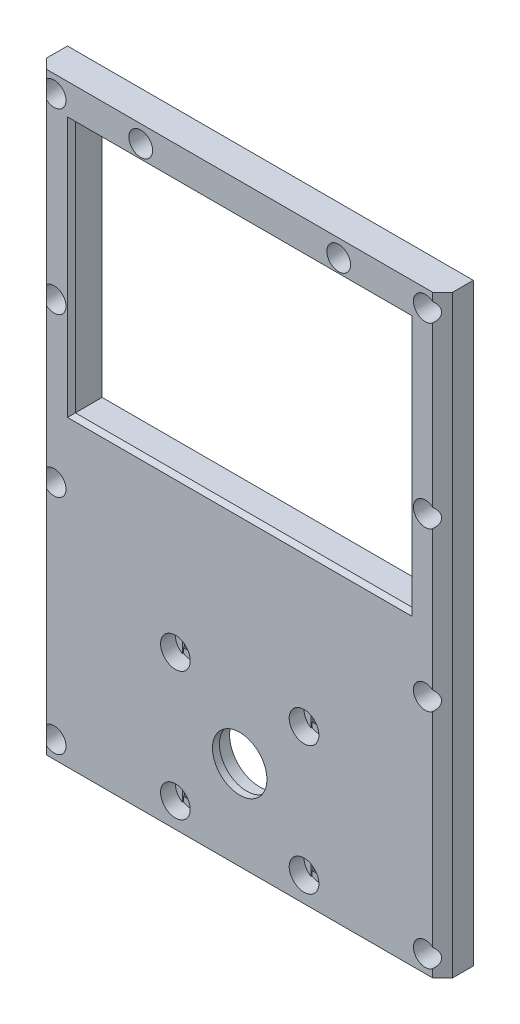
from build123d import *

# Parameters (mm, degrees)
SKETCH1_W           = 82
SKETCH1_H           = 120
SKETCH1_W_2         = 68
SKETCH1_H_2         = 106
BOSS_EXTRUDE1_DEPTH = 7
SKETCH2_W           = 68
SKETCH2_H           = 36
BOSS_EXTRUDE2_DEPTH = 7
SKETCH3_R           = 5.5
CUT_EXTRUDE1_DEPTH  = 74.006848994
SKETCH4_R           = 6.05
CUT_EXTRUDE2_DEPTH  = 5.6
SKETCH5_R           = 11
CUT_EXTRUDE3_DEPTH  = 3
SKETCH6_R           = 1.6
CUT_EXTRUDE4_DEPTH  = 74.006848994
SKETCH7_W           = 50
SKETCH7_H           = 38
CUT_EXTRUDE5_DEPTH  = 1
SKETCH8_R           = 3
CUT_EXTRUDE6_DEPTH  = 3
SKETCH9_R           = 1.35
CUT_EXTRUDE7_DEPTH  = 74.006848994
SKETCH10_R          = 2.4
CUT_EXTRUDE8_DEPTH  = 5
CHAMFER1_SIZE       = 2
SKETCH11_W          = 68
SKETCH11_H          = 19
BOSS_EXTRUDE3_DEPTH = 7
SKETCH12_R          = 1.35
CUT_EXTRUDE9_DEPTH  = 74.006848994
SKETCH13_R          = 2.4
CUT_EXTRUDE10_DEPTH = 5
CHAMFER2_SIZE       = 0.8
CUT_EXTRUDE11_DEPTH = 0.2
SKETCH15_W          = 2.7
SKETCH15_H          = 2.7
CUT_EXTRUDE12_DEPTH = 0.2
CUT_EXTRUDE13_DEPTH = 0.2
SKETCH17_W          = 3.2
SKETCH17_H          = 3.2
CUT_EXTRUDE14_DEPTH = 0.2


with BuildPart() as part:
    # Sketch1 → Boss-Extrude1 (new body)
    with BuildSketch(Plane.XY):
        Rectangle(SKETCH1_W, SKETCH1_H)
        Rectangle(SKETCH1_W_2, SKETCH1_H_2, mode=Mode.SUBTRACT)
    extrude(amount=BOSS_EXTRUDE1_DEPTH)

    # Sketch2 → Boss-Extrude2 (add)
    with BuildSketch(Plane.XY.offset(7)):
        with Locations((0, -35)):
            Rectangle(SKETCH2_W, SKETCH2_H)
    extrude(amount=-BOSS_EXTRUDE2_DEPTH)

    # Sketch3 → Cut-Extrude1 (cut, through all)
    with BuildSketch(Plane(origin=(0, 0, 0), x_dir=(-1, 0, 0), z_dir=(0, 0, -1))):
        with Locations((0, -42)):
            Circle(SKETCH3_R)
    extrude(amount=-CUT_EXTRUDE1_DEPTH, mode=Mode.SUBTRACT)

    # Sketch4 → Cut-Extrude2 (cut)
    with BuildSketch(Plane(origin=(0, 0, 0), x_dir=(-1, 0, 0), z_dir=(0, 0, -1))):
        with Locations((0, -42)):
            Circle(SKETCH4_R)
    extrude(amount=-CUT_EXTRUDE2_DEPTH, mode=Mode.SUBTRACT)

    # Sketch5 → Cut-Extrude3 (cut)
    with BuildSketch(Plane(origin=(0, 0, 0), x_dir=(-1, 0, 0), z_dir=(0, 0, -1))):
        with Locations((0, -42)):
            Circle(SKETCH5_R)
    extrude(amount=-CUT_EXTRUDE3_DEPTH, mode=Mode.SUBTRACT)

    # Sketch6 → Cut-Extrude4 (cut, through all)
    with BuildSketch(Plane(origin=(0, 0, 0), x_dir=(-1, 0, 0), z_dir=(0, 0, -1))):
        with Locations((-13, -29)):
            Circle(SKETCH6_R)
        with Locations((13, -29)):
            Circle(SKETCH6_R)
        with Locations((13, -55)):
            Circle(SKETCH6_R)
        with Locations((-13, -55)):
            Circle(SKETCH6_R)
    extrude(amount=-CUT_EXTRUDE4_DEPTH, mode=Mode.SUBTRACT)

    # Sketch7 → Cut-Extrude5 (cut)
    with BuildSketch(Plane(origin=(0, 0, 0), x_dir=(-1, 0, 0), z_dir=(0, 0, -1))):
        with Locations((0, -42)):
            Rectangle(SKETCH7_W, SKETCH7_H)
    extrude(amount=-CUT_EXTRUDE5_DEPTH, mode=Mode.SUBTRACT)

    # Sketch8 → Cut-Extrude6 (cut)
    with BuildSketch(Plane.XY.offset(7)):
        with Locations((-13, -29)):
            Circle(SKETCH8_R)
        with Locations((13, -29)):
            Circle(SKETCH8_R)
        with Locations((13, -55)):
            Circle(SKETCH8_R)
        with Locations((-13, -55)):
            Circle(SKETCH8_R)
    extrude(amount=-CUT_EXTRUDE6_DEPTH, mode=Mode.SUBTRACT)

    # Sketch9 → Cut-Extrude7 (cut, through all)
    with BuildSketch(Plane.XY.offset(7)):
        with Locations((-37.5, 56.5)):
            Circle(SKETCH9_R)
        with Locations((37.5, 56.5)):
            Circle(SKETCH9_R)
        with Locations((-37.5, -56.5)):
            Circle(SKETCH9_R)
        with Locations((37.5, -56.5)):
            Circle(SKETCH9_R)
        with Locations((-37.5, 20.5)):
            Circle(SKETCH9_R)
        with Locations((37.5, 20.5)):
            Circle(SKETCH9_R)
        with Locations((37.5, -11.5)):
            Circle(SKETCH9_R)
        with Locations((-37.5, -11.5)):
            Circle(SKETCH9_R)
    extrude(amount=-CUT_EXTRUDE7_DEPTH, mode=Mode.SUBTRACT)

    # Sketch10 → Cut-Extrude8 (cut)
    with BuildSketch(Plane.XY.offset(7)):
        with Locations((-37.5, 56.5)):
            Circle(SKETCH10_R)
        with Locations((37.5, 20.5)):
            Circle(SKETCH10_R)
        with Locations((-37.5, 20.5)):
            Circle(SKETCH10_R)
        with Locations((37.5, 56.5)):
            Circle(SKETCH10_R)
        with Locations((-37.5, -56.5)):
            Circle(SKETCH10_R)
        with Locations((37.5, -56.5)):
            Circle(SKETCH10_R)
        with Locations((-37.5, -11.5)):
            Circle(SKETCH10_R)
        with Locations((37.5, -11.5)):
            Circle(SKETCH10_R)
    extrude(amount=-CUT_EXTRUDE8_DEPTH, mode=Mode.SUBTRACT)

    # Chamfer1
    # the kernel refuses this chamfer: 2 mm, written as the material it takes off along each edge
    with BuildSketch(Plane(origin=(-41, 65.143365976, 7), x_dir=(0.9996219169112968, 0, 0.02749587661058651), z_dir=(0, -1, 0))) as chamfer1_piece_1:
        Polygon((CHAMFER1_SIZE * 0.999621916911, -CHAMFER1_SIZE * 0.0274958766106), (-CHAMFER1_SIZE * 0.0274958766106, -CHAMFER1_SIZE * 0.999621916911), (0, 0), align=None)
    extrude(amount=130.286731952, mode=Mode.SUBTRACT)
    with BuildSketch(Plane(origin=(41, -65.143365976, 7), x_dir=(0.027495876610585623, 0, -0.9996219169112968), z_dir=(0, 1, 0))) as chamfer1_piece_2:
        Polygon((CHAMFER1_SIZE * 0.999621916911, CHAMFER1_SIZE * 0.0274958766106), (-CHAMFER1_SIZE * 0.0274958766106, CHAMFER1_SIZE * 0.999621916911), (0, 0), align=None)
    extrude(amount=130.286731952, mode=Mode.SUBTRACT)

    # Sketch11 → Boss-Extrude3 (add)
    with BuildSketch(Plane.XY.offset(7)):
        with Locations((0, -7.5)):
            Rectangle(SKETCH11_W, SKETCH11_H)
    extrude(amount=-BOSS_EXTRUDE3_DEPTH)

    # Sketch12 → Cut-Extrude9 (cut, through all)
    with BuildSketch(Plane.XY.offset(7)):
        with Locations((-20, 56.5)):
            Circle(SKETCH12_R)
        with Locations((20, 56.5)):
            Circle(SKETCH12_R)
    extrude(amount=-CUT_EXTRUDE9_DEPTH, mode=Mode.SUBTRACT)

    # Sketch13 → Cut-Extrude10 (cut)
    with BuildSketch(Plane.XY.offset(7)):
        with Locations((-20, 56.5)):
            Circle(SKETCH13_R)
        with Locations((20, 56.5)):
            Circle(SKETCH13_R)
    extrude(amount=-CUT_EXTRUDE10_DEPTH, mode=Mode.SUBTRACT)

    # Chamfer2
    chamfer2_edges = [part.edges().sort_by_distance(p)[0] for p in [
        (0, 53, 0),
        (-34, 27.5, 0),
        (0, 53, 7),
        (-34, 27.5, 7),
        (34, 27.5, 7),
        (34, 27.5, 0),
        (0, 2, 7),
        (0, 2, 0),
        (-33, -60, 0),
        (-41, 0, 0),
        (0, 60, 0),
        (41, 0, 0),
    ]]
    chamfer(chamfer2_edges, length=CHAMFER2_SIZE)

    # Sketch14 → Cut-Extrude11 (cut)
    with BuildSketch(Plane.XY.offset(2)):
        with BuildLine():
            Line((-38.85, -13.484313483), (-38.85, -9.515686517))
            ThreePointArc((-38.85, -9.515686517), (-37.5, -9.1), (-36.15, -9.515686517))
            Line((-36.15, -9.515686517), (-36.15, -13.484313483))
            ThreePointArc((-36.15, -13.484313483), (-37.5, -13.9), (-38.85, -13.484313483))
        make_face()
        with BuildLine():
            Line((-38.85, -58.484313483), (-38.85, -54.515686517))
            ThreePointArc((-38.85, -54.515686517), (-37.5, -54.1), (-36.15, -54.515686517))
            Line((-36.15, -54.515686517), (-36.15, -58.484313483))
            ThreePointArc((-36.15, -58.484313483), (-37.5, -58.9), (-38.85, -58.484313483))
        make_face()
        with BuildLine():
            Line((-38.85, 18.515686517), (-38.85, 22.484313483))
            ThreePointArc((-38.85, 22.484313483), (-37.5, 22.9), (-36.15, 22.484313483))
            Line((-36.15, 22.484313483), (-36.15, 18.515686517))
            ThreePointArc((-36.15, 18.515686517), (-37.5, 18.1), (-38.85, 18.515686517))
        make_face()
        with BuildLine():
            Line((-21.35, 54.515686517), (-21.35, 58.484313483))
            ThreePointArc((-21.35, 58.484313483), (-20, 58.9), (-18.65, 58.484313483))
            Line((-18.65, 58.484313483), (-18.65, 54.515686517))
            ThreePointArc((-18.65, 54.515686517), (-20, 54.1), (-21.35, 54.515686517))
        make_face()
        with BuildLine():
            Line((-38.85, 54.515686517), (-38.85, 58.484313483))
            ThreePointArc((-38.85, 58.484313483), (-37.5, 58.9), (-36.15, 58.484313483))
            Line((-36.15, 58.484313483), (-36.15, 54.515686517))
            ThreePointArc((-36.15, 54.515686517), (-37.5, 54.1), (-38.85, 54.515686517))
        make_face()
    cut_extrude11 = extrude(amount=-CUT_EXTRUDE11_DEPTH, mode=Mode.SUBTRACT)

    # Sketch15 → Cut-Extrude12 (cut)
    with BuildSketch(Plane.XY.offset(1.8)):
        with Locations((-37.5, -56.5)):
            Rectangle(SKETCH15_W, SKETCH15_H)
        with Locations((-37.5, -11.5)):
            Rectangle(SKETCH15_W, SKETCH15_H)
        with Locations((-37.5, 20.5)):
            Rectangle(SKETCH15_W, SKETCH15_H)
        with Locations((-37.5, 56.5)):
            Rectangle(SKETCH15_W, SKETCH15_H)
        with Locations((-20, 56.5)):
            Rectangle(SKETCH15_W, SKETCH15_H)
    cut_extrude12 = extrude(amount=-CUT_EXTRUDE12_DEPTH, mode=Mode.SUBTRACT)

    # Sketch16 → Cut-Extrude13 (cut)
    with BuildSketch(Plane.XY.offset(4)):
        with BuildLine():
            Line((-14.6, -31.537715508), (-14.6, -26.462284492))
            ThreePointArc((-14.6, -26.462284492), (-13, -26), (-11.4, -26.462284492))
            Line((-11.4, -26.462284492), (-11.4, -31.537715508))
            ThreePointArc((-11.4, -31.537715508), (-13, -32), (-14.6, -31.537715508))
        make_face()
        with BuildLine():
            Line((-14.6, -57.537715508), (-14.6, -52.462284492))
            ThreePointArc((-14.6, -52.462284492), (-13, -52), (-11.4, -52.462284492))
            Line((-11.4, -52.462284492), (-11.4, -57.537715508))
            ThreePointArc((-11.4, -57.537715508), (-13, -58), (-14.6, -57.537715508))
        make_face()
    cut_extrude13 = extrude(amount=-CUT_EXTRUDE13_DEPTH, mode=Mode.SUBTRACT)

    # Sketch17 → Cut-Extrude14 (cut)
    with BuildSketch(Plane.XY.offset(3.8)):
        with Locations((-13, -29)):
            Rectangle(SKETCH17_W, SKETCH17_H)
        with Locations((-13, -55)):
            Rectangle(SKETCH17_W, SKETCH17_H)
    cut_extrude14 = extrude(amount=-CUT_EXTRUDE14_DEPTH, mode=Mode.SUBTRACT)

    # Mirror1: Cut-Extrude11, Cut-Extrude12, Cut-Extrude13, Cut-Extrude14 across plane
    add(cut_extrude11.mirror(Plane(origin=(0, 0, 0), x_dir=(0, 0, 1), z_dir=(1, 0, 0))), mode=Mode.SUBTRACT)
    add(cut_extrude12.mirror(Plane(origin=(0, 0, 0), x_dir=(0, 0, 1), z_dir=(1, 0, 0))), mode=Mode.SUBTRACT)
    add(cut_extrude13.mirror(Plane(origin=(0, 0, 0), x_dir=(0, 0, 1), z_dir=(1, 0, 0))), mode=Mode.SUBTRACT)
    add(cut_extrude14.mirror(Plane(origin=(0, 0, 0), x_dir=(0, 0, 1), z_dir=(1, 0, 0))), mode=Mode.SUBTRACT)


solid = part.part
